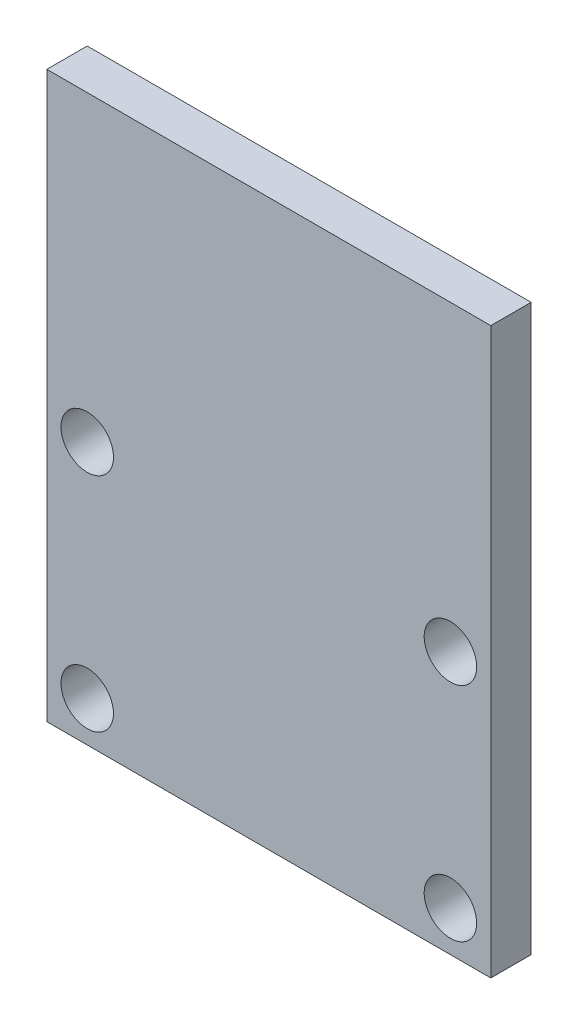
from build123d import *

# Parameters (mm, degrees)
SKETCH_1_W      = 22
SKETCH_1_H      = 28
SKETCH_1_R      = 1.3
EXTRUDE_1_DEPTH = 2


with BuildPart() as part:
    # 草图1 → 凸台-拉伸1 (new body)
    with BuildSketch(Plane.XY):
        Rectangle(SKETCH_1_W, SKETCH_1_H)
        with Locations((-9, -11.997945994)):
            Circle(SKETCH_1_R, mode=Mode.SUBTRACT)
        with Locations((-9, -0.997945994)):
            Circle(SKETCH_1_R, mode=Mode.SUBTRACT)
        with Locations((9, -0.997945994)):
            Circle(SKETCH_1_R, mode=Mode.SUBTRACT)
        with Locations((9, -11.997945994)):
            Circle(SKETCH_1_R, mode=Mode.SUBTRACT)
    extrude(amount=EXTRUDE_1_DEPTH)


solid = part.part
